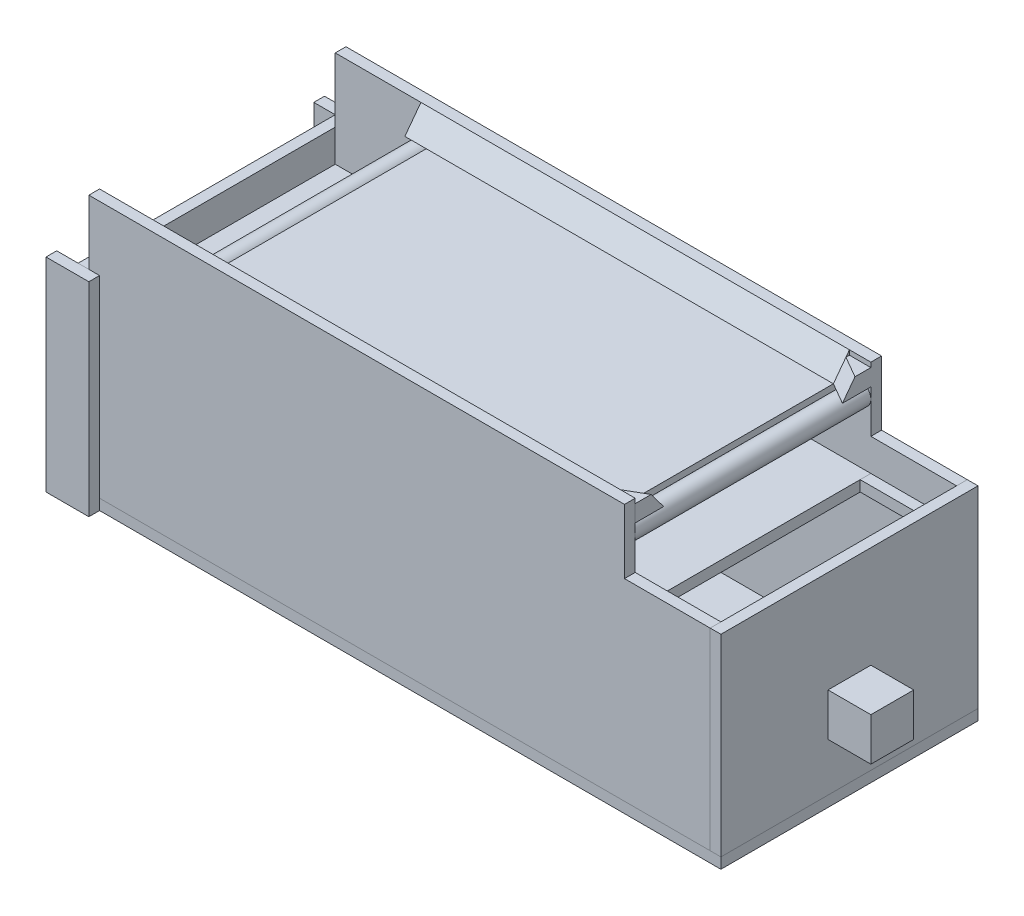
from build123d import *

# Parameters (mm, degrees)
SKETCH1_W                             = 660.4
SKETCH1_H                             = 304.8
SKETCH1_W_2                           = 101.6
FOND_DEPTH                            = 12.7
SKETCH2_W                             = 736.6
SKETCH2_H                             = 12.7
COT_S_HAUT_DEPTH                      = 228.6
COT_S_HAUT_2_DEPTH                    = 228.6
SKETCH3_W                             = 12.7
SKETCH3_H                             = 304.8
COT_ES_BAS_DEPTH                      = 228.6
COT_ES_BAS_2_DEPTH                    = 228.6
SKETCH4_W                             = 635
SKETCH4_H                             = 12.7
SUPPORT_CAGE_DEPTH                    = 76.2
SKETCH5_W                             = 12.7
SKETCH5_H                             = 12.7
SUPPORT_TRAPPE_COT_ES_DEPTH           = 101.6
SUPPORT_TRAPPE_COT_ES_2_DEPTH         = 101.6
SUPPORT_TRAPPE_DEVANT_REACH           = 606.419
SKETCH6_W                             = 12.7
SKETCH6_H                             = 12.7
PLANCHER_MILLIEU_REACH                = 612.393
SKETCH7_W                             = 635
SKETCH7_H                             = 12.7
ROULEAU_REACH                         = 612.393
SKETCH8_R                             = 12.7
SKETCH10_W                            = 482.6
SKETCH10_H                            = 12.7
SOUTIEN_TAPIS_DEPTH                   = 279.4
REBORD_START                          = -25.4
REBORD_TAPIS_DEPTH                    = 508
V_POUR_VIS_SANS_FIN_DEPTH             = 177.8
TROU_V_VIS_SANS_FIN_REACH             = 559.21
SKETCH17_W                            = 25.4
SKETCH17_H                            = 19.05
TROU_V_VIS_SANS_FIN_DIRECTION_2_REACH = 559.21
TROU_SORTIE_VIS_SANS_FIN_DEPTH        = 12.7
TROU_SORTIE_VIS_SANS_FIN_DEPTH_BACK   = 12.7
SKETCH18_W                            = 12.7
SKETCH18_H                            = 25.4
SKETCH19_W                            = 12.7
SKETCH19_H                            = 241.3
REBORD_POUR_SAC_POUBELLE_DEPTH        = 25.4
SKETCH31_W                            = 50.8
SKETCH31_H                            = 50.8
BOITE_MOTEUR_VIS_SANS_DEPTH           = 50.8


with BuildPart() as part:
    # Sketch1 → Fond (new body)
    with BuildSketch(Plane(origin=(0, 0, 0), x_dir=(1, 0, 0), z_dir=(0, 1, 0))):
        Rectangle(SKETCH1_W, SKETCH1_H)
        with Locations((381, 0)):
            Rectangle(SKETCH1_W_2, SKETCH1_H)
    extrude(amount=FOND_DEPTH)


with BuildPart() as body_2:
    # Sketch2 → Cotés Haut (new body)
    with BuildSketch(Plane(origin=(0, 12.7, 0), x_dir=(1, 0, 0), z_dir=(0, 1, 0))):
        with Locations((50.8, 146.05)):
            Rectangle(SKETCH2_W, SKETCH2_H)
    extrude(amount=COT_S_HAUT_DEPTH)



with BuildPart() as body_3:
    # Sketch2 → Cot_s Haut 2 (new body)
    with BuildSketch(Plane(origin=(0, 12.7, 0), x_dir=(1, 0, 0), z_dir=(0, 1, 0))):
        with Locations((50.8, -146.05)):
            Rectangle(SKETCH2_W, SKETCH2_H)
    extrude(amount=COT_S_HAUT_2_DEPTH)


with BuildPart() as body_4:
    # Sketch3 → Cotées Bas (new body)
    with BuildSketch(Plane(origin=(0, 12.7, 0), x_dir=(1, 0, 0), z_dir=(0, 1, 0))):
        with Locations((-323.85, 0)):
            Rectangle(SKETCH3_W, SKETCH3_H)
    extrude(amount=COT_ES_BAS_DEPTH)


with BuildPart() as body_5:
    # Sketch3 → Cot_es Bas 2 (new body)
    with BuildSketch(Plane(origin=(0, 12.7, 0), x_dir=(1, 0, 0), z_dir=(0, 1, 0))):
        with Locations((425.45, 0)):
            Rectangle(SKETCH3_W, SKETCH3_H)
    extrude(amount=COT_ES_BAS_2_DEPTH)

    # Sketch18 → Trou sortie vis sans fin (cut, two sides: drawn at the far end of the back side and taken through both)
    with BuildSketch(Plane.XY.offset(-TROU_SORTIE_VIS_SANS_FIN_DEPTH_BACK)):
        with Locations((425.45, 101.6)):
            Rectangle(SKETCH18_W, SKETCH18_H)
    extrude(amount=TROU_SORTIE_VIS_SANS_FIN_DEPTH + TROU_SORTIE_VIS_SANS_FIN_DEPTH_BACK, mode=Mode.SUBTRACT)


with BuildPart() as body_2_1:
    add(body_2.part)

    add(body_3.part)  # Support Cage merges body 3
    # Sketch4 → Support Cage (add)
    with BuildSketch(Plane(origin=(0, 241.3, 0), x_dir=(1, 0, 0), z_dir=(0, 1, 0))):
        with Locations((0, 146.05)):
            Rectangle(SKETCH4_W, SKETCH4_H)
        with Locations((0, -146.05)):
            Rectangle(SKETCH4_W, SKETCH4_H)
    extrude(amount=SUPPORT_CAGE_DEPTH)


with BuildPart() as body_5_2:
    # Sketch5 → Support Trappe cotées (new body)
    with BuildSketch(Plane.ZY.offset(-419.1)):
        with Locations((-133.35, 196.85)):
            Rectangle(SKETCH5_W, SKETCH5_H)
    extrude(amount=SUPPORT_TRAPPE_COT_ES_DEPTH)


with BuildPart() as body_6:
    # Sketch5 → Support Trappe cot_es 2 (new body)
    with BuildSketch(Plane.ZY.offset(-419.1)):
        with Locations((133.35, 196.85)):
            Rectangle(SKETCH5_W, SKETCH5_H)
    extrude(amount=SUPPORT_TRAPPE_COT_ES_2_DEPTH)


with BuildPart() as body_7:

    # Sketch6 → Support Trappe devant (new, up to next)
    with BuildSketch(Plane.XY.offset(-127), mode=Mode.PRIVATE) as support_trappe_devant_sk1:
        with Locations((412.75, 196.85)):
            Rectangle(SKETCH6_W, SKETCH6_H)
    support_trappe_devant_tool1 = extrude(support_trappe_devant_sk1.sketch, amount=SUPPORT_TRAPPE_DEVANT_REACH, mode=Mode.PRIVATE) - body_6.part
    add(support_trappe_devant_tool1.solids().sort_by_distance((412.75, 196.85, -127))[0])


with BuildPart() as body_8:

    # Sketch7 → Plancher millieu (new, up to next)
    with BuildSketch(Plane(origin=(0, 0, 139.7), x_dir=(-1, 0, 0), z_dir=(0, 0, -1)), mode=Mode.PRIVATE) as plancher_millieu_sk1:
        with Locations((0, 196.85)):
            Rectangle(SKETCH7_W, SKETCH7_H)
    plancher_millieu_tool1 = extrude(plancher_millieu_sk1.sketch, amount=PLANCHER_MILLIEU_REACH, mode=Mode.PRIVATE) - body_2_1.part
    add(plancher_millieu_tool1.solids().sort_by_distance((0, 196.85, 139.7))[0])


with BuildPart() as body_9:

    # Sketch8 → Rouleau (new, up to next)
    with BuildSketch(Plane(origin=(0, 0, 139.7), x_dir=(-1, 0, 0), z_dir=(0, 0, -1)), mode=Mode.PRIVATE) as rouleau_sk1:
        with Locations((-304.8, 279.4)):
            Circle(SKETCH8_R)
    rouleau_tool1 = extrude(rouleau_sk1.sketch, amount=ROULEAU_REACH, mode=Mode.PRIVATE) - body_2_1.part
    rouleau = rouleau_tool1.solids().sort_by_distance((304.8, 279.4, 139.7))[0]
    add(rouleau)


with BuildPart() as body_2_2:
    add(body_2_1.part)

    # Mirror1: Rouleau across plane
    add(rouleau.mirror(Plane(origin=(50.8, 0, 0), x_dir=(0, 0, 1), z_dir=(1, 0, 0))))

    # Mirror9 2: loft between two sections, ruled curve by curve
    mirror9_2_from = [
        Edge.make_line((317.5, 311.912, -120.844303163), (317.5, 311.912, -139.7)),
        Edge.make_line((317.5, 292.1, -139.7), (317.5, 292.1, -105.985303163)),
        Edge.make_line((317.5, 292.1, -105.985303163), (317.5, 311.912, -120.844303163)),
        Edge.make_line((317.5, 292.1, -139.7), (317.5, 311.912, -139.7)),
    ]
    mirror9_2_to = [
        Edge.make_line((292.1, 311.912, -135.509), (292.1, 311.912, -139.7)),
        Edge.make_line((292.1, 292.1, -139.7), (292.1, 292.1, -120.65)),
        Edge.make_line((292.1, 292.1, -120.65), (292.1, 311.912, -135.509)),
        Edge.make_line((292.1, 292.1, -139.7), (292.1, 311.912, -139.7)),
    ]
    mirror9_2 = Solid(Shell([*[Face.make_surface_from_curves(mirror9_2_from[k], mirror9_2_to[k]) for k in range(4)], Face(Wire(mirror9_2_from)), Face(Wire(mirror9_2_to))]))
    add(mirror9_2)


with BuildPart() as body_10:
    # Sketch10 → Soutien tapis (new body)
    with BuildSketch(Plane(origin=(0, 0, 139.7), x_dir=(-1, 0, 0), z_dir=(0, 0, -1))):
        with Locations((-50.8, 285.75)):
            Rectangle(SKETCH10_W, SKETCH10_H)
    extrude(amount=SOUTIEN_TAPIS_DEPTH)


with BuildPart() as body_11:
    # Sketch11 → Rebord tapis (new body)
    with BuildSketch(Plane(origin=(317.5, 0, 0), x_dir=(0, 0, -1), z_dir=(1, 0, 0)).offset(REBORD_START)):
        Polygon((-139.7, 317.5), (-120.65, 292.1), (-139.7, 292.1), align=None)
    rebord_tapis = extrude(amount=-REBORD_TAPIS_DEPTH)


with BuildPart() as body_10_1:
    add(body_10.part)

    # Mirror5: Rebord tapis across plane
    add(rebord_tapis.mirror(Plane.XY))

    # Mirror9: read off the stored shape, not the designer's step
    # Mirror9: loft between two sections, ruled curve by curve
    mirror9_from = [
        Edge.make_line((317.5, 292.1, -139.7), (317.5, 292.1, -105.985303163)),
        Edge.make_line((317.5, 311.912, -120.844303163), (317.5, 311.912, -139.7)),
        Edge.make_line((317.5, 292.1, -105.985303163), (317.5, 311.912, -120.844303163)),
        Edge.make_line((317.5, 311.912, -139.7), (317.5, 292.1, -139.7)),
    ]
    mirror9_to = [
        Edge.make_line((292.1, 292.1, -139.7), (292.1, 292.1, -120.65)),
        Edge.make_line((292.1, 311.912, -135.509), (292.1, 311.912, -139.7)),
        Edge.make_line((292.1, 292.1, -120.65), (292.1, 311.912, -135.509)),
        Edge.make_line((292.1, 311.912, -139.7), (292.1, 292.1, -139.7)),
    ]
    mirror9 = Solid(Shell([*[Face.make_surface_from_curves(mirror9_from[k], mirror9_to[k]) for k in range(4)], Face(Wire(mirror9_from)), Face(Wire(mirror9_to))]))
    add(mirror9)


with BuildPart() as body_12:
    # Sketch13 → V pour vis sans fin (new body)
    with BuildSketch(Plane(origin=(0, 12.7, 0), x_dir=(1, 0, 0), z_dir=(0, 1, 0))):
        Polygon((-273.505909488, 0), (-317.5, 25.4), (-317.5, -25.4), align=None)
    extrude(amount=V_POUR_VIS_SANS_FIN_DEPTH)

    # Trou V vis sans fin: up to this face of the body (flat: up to its plane)
    trou_v_vis_sans_fin_end = Plane(body_12.part.faces().sort_by_distance((-295.502954744, 101.6, -12.7))[0])
    # Sketch17 → Trou V vis sans fin (cut, up to the picked face)
    with BuildSketch(Plane.XY, mode=Mode.PRIVATE) as trou_v_vis_sans_fin_sk1:
        with Locations((-286.205909488, 101.6)):
            Rectangle(SKETCH17_W, SKETCH17_H)
    trou_v_vis_sans_fin_tool1 = split(extrude(trou_v_vis_sans_fin_sk1.sketch, amount=-TROU_V_VIS_SANS_FIN_REACH, mode=Mode.PRIVATE), bisect_by=trou_v_vis_sans_fin_end, keep=Keep.BOTH, mode=Mode.PRIVATE)
    add(trou_v_vis_sans_fin_tool1.solids().sort_by(Axis((-286.205909, 101.6, 0), (0, 0, -1)))[0], mode=Mode.SUBTRACT)

    # Trou V vis sans fin direction 2: up to this face of the body (flat: up to its plane)
    trou_v_vis_sans_fin_direction_2_end = Plane(body_12.part.faces().sort_by_distance((-295.502954744, 101.6, 12.7))[0])
    # Sketch17 → Trou V vis sans fin direction 2 (cut, up to the picked face)
    with BuildSketch(Plane.XY, mode=Mode.PRIVATE) as trou_v_vis_sans_fin_direction_2_sk1:
        with Locations((-286.205909488, 101.6)):
            Rectangle(SKETCH17_W, SKETCH17_H)
    trou_v_vis_sans_fin_direction_2_tool1 = split(extrude(trou_v_vis_sans_fin_direction_2_sk1.sketch, amount=TROU_V_VIS_SANS_FIN_DIRECTION_2_REACH, mode=Mode.PRIVATE), bisect_by=trou_v_vis_sans_fin_direction_2_end, keep=Keep.BOTH, mode=Mode.PRIVATE)
    add(trou_v_vis_sans_fin_direction_2_tool1.solids().sort_by(Axis((-286.205909, 101.6, 0), (0, 0, 1)))[0], mode=Mode.SUBTRACT)


with BuildPart() as body_13:
    # Sketch19 → Rebord pour sac poubelle (new, symmetric)
    with BuildSketch(Plane.ZY.offset(330.2)):
        with Locations((-158.75, 120.65)):
            Rectangle(SKETCH19_W, SKETCH19_H)
    rebord_pour_sac_poubelle = extrude(amount=REBORD_POUR_SAC_POUBELLE_DEPTH, both=True)


with BuildPart() as body_14:
    # Rebord pour sac poubelle 2: read off the stored shape, not the designer's step
    # Rebord pour sac poubelle 2: loft between two sections, ruled curve by curve
    rebord_pour_sac_poubelle_2_from = [
        Edge.make_line((292.1, 292.1, 120.65), (292.1, 292.1, 139.7)),
        Edge.make_line((292.1, 292.1, 139.7), (317.5, 292.1, 139.7)),
        Edge.make_line((317.5, 292.1, 105.985303163), (292.1, 292.1, 120.65)),
        Edge.make_line((317.5, 292.1, 139.7), (317.5, 292.1, 105.985303163)),
    ]
    rebord_pour_sac_poubelle_2_to = [
        Edge.make_line((292.1, 311.912, 135.509), (292.1, 311.912, 139.7)),
        Edge.make_line((292.1, 311.912, 139.7), (317.5, 311.912, 139.7)),
        Edge.make_line((317.5, 311.912, 120.844303163), (292.1, 311.912, 135.509)),
        Edge.make_line((317.5, 311.912, 139.7), (317.5, 311.912, 120.844303163)),
    ]
    rebord_pour_sac_poubelle_2 = Solid(Shell([*[Face.make_surface_from_curves(rebord_pour_sac_poubelle_2_from[k], rebord_pour_sac_poubelle_2_to[k]) for k in range(4)], Face(Wire(rebord_pour_sac_poubelle_2_from)), Face(Wire(rebord_pour_sac_poubelle_2_to))]))
    add(rebord_pour_sac_poubelle_2)


with BuildPart() as body_15:
    # Sketch31 → Boite moteur vis sans (new body)
    with BuildSketch(Plane(origin=(431.8, 0, 0), x_dir=(0, 0, -1), z_dir=(1, 0, 0))):
        with Locations((0, 95.25)):
            Rectangle(SKETCH31_W, SKETCH31_H)
    extrude(amount=BOITE_MOTEUR_VIS_SANS_DEPTH)


with BuildPart() as body_2_3:
    add(body_2_2.part)

    # Mirror11: Rebord pour sac poubelle across plane
    add(rebord_pour_sac_poubelle.mirror(Plane.XY))


solid = Compound([part.part, body_4.part, body_5.part, body_5_2.part, body_6.part, body_7.part, body_8.part, body_9.part, body_11.part, body_10_1.part, body_12.part, body_13.part, body_14.part, body_15.part, body_2_3.part])
